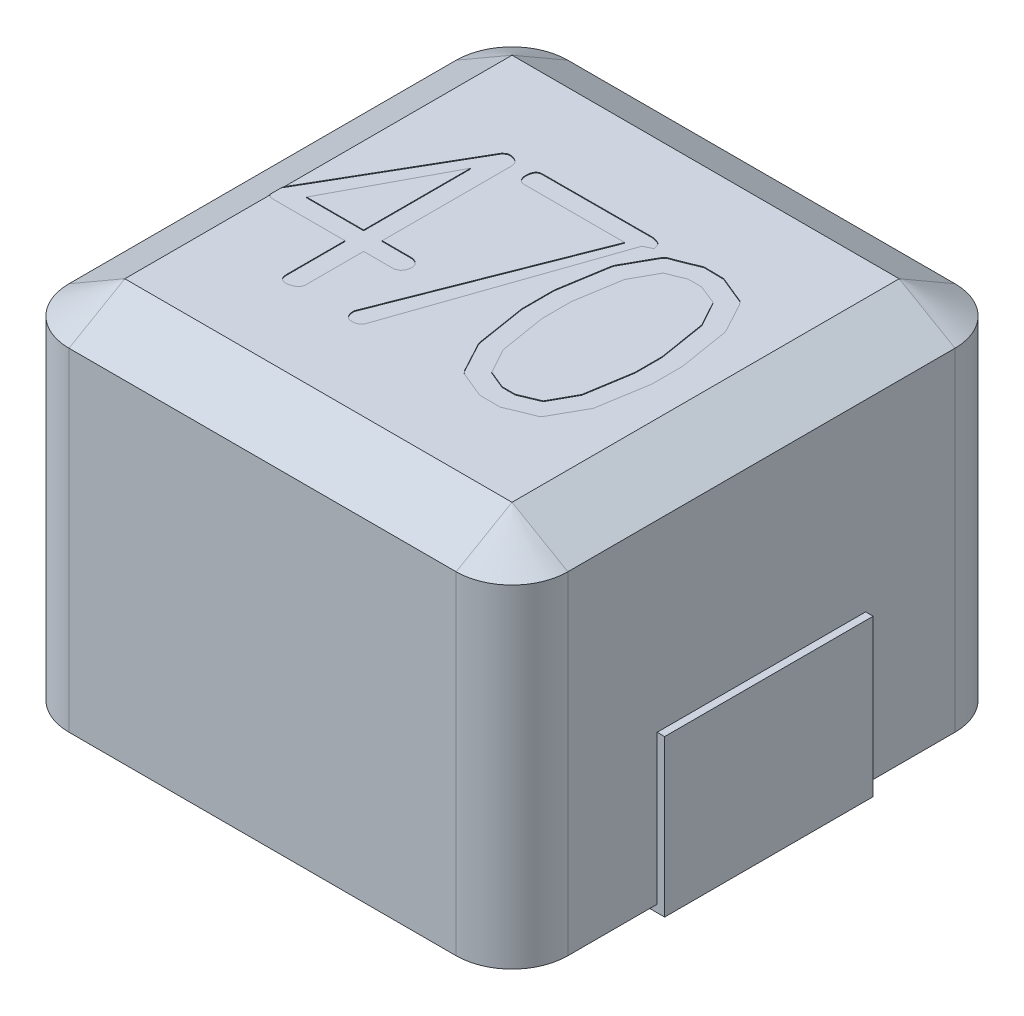
from build123d import *

# Parameters (mm, degrees)
BOSS_EXTRUDE1_DEPTH      = 4.9
BOSS_EXTRUDE3_DEPTH      = 0.1
BOSS_EXTRUDE3_DEPTH_BACK = 2
SKETCH4_W                = 1.45
SKETCH4_H                = 2.8
CHAMFER1_SIZE            = 0.75
CHAMFER1_SIZE_2          = 0.433012702
CUT_EXTRUDE1_DEPTH       = 0.01


with BuildPart() as part:
    # Sketch1 → Boss-Extrude1 (new body)
    with BuildSketch(Plane(origin=(0, 0, 0), x_dir=(1, 0, 0), z_dir=(0, 1, 0))):
        with BuildLine():
            Line((2.6, -3.35), (-2.6, -3.35))
            ThreePointArc((-2.6, -3.35), (-3.130330086, -3.130330086), (-3.35, -2.6))
            Line((-3.35, -2.6), (-3.35, 2.6))
            ThreePointArc((-3.35, 2.6), (-3.130330086, 3.130330086), (-2.6, 3.35))
            Line((-2.6, 3.35), (2.6, 3.35))
            ThreePointArc((2.6, 3.35), (3.130330086, 3.130330086), (3.35, 2.6))
            Line((3.35, 2.6), (3.35, -2.6))
            ThreePointArc((3.35, -2.6), (3.130330086, -3.130330086), (2.6, -3.35))
        make_face()
    extrude(amount=BOSS_EXTRUDE1_DEPTH)

    # Sketch4 → Boss-Extrude3 (add, two sides: drawn at the far end of the back side and taken through both)
    with BuildSketch(Plane.XZ.offset(-BOSS_EXTRUDE3_DEPTH_BACK)):
        with Locations((-2.725, 0)):
            Rectangle(SKETCH4_W, SKETCH4_H)
        with Locations((2.725, 0)):
            Rectangle(SKETCH4_W, SKETCH4_H)
    extrude(amount=BOSS_EXTRUDE3_DEPTH + BOSS_EXTRUDE3_DEPTH_BACK)

    # Chamfer1
    # the kernel refuses this chamfer: 0.75, 0.433012702 mm, written as the material it takes off along each edge
    with BuildSketch(Plane(origin=(2.6, 4.9, -2.6), x_dir=(0, 0, -1), z_dir=(-1, 0, 0))) as chamfer1_piece_1:
        Polygon((0.75 - CHAMFER1_SIZE, 0), (0.75, CHAMFER1_SIZE_2), (0.75, 0), align=None)
    revolve(axis=Axis((2.6, 4.9, -2.6), (0, -1, 0)), revolution_arc=90, mode=Mode.SUBTRACT)
    with BuildSketch(Plane(origin=(-2.6, 4.9, -3.35), x_dir=(0, 0, 1), z_dir=(1, 0, 0)), Plane(origin=(-3.35, 4.9, 2.6), x_dir=(1, 0, 0), z_dir=(0, 0, -1)), Plane(origin=(3.35, 4.9, -2.6), x_dir=(-1, 0, 0), z_dir=(0, 0, 1))) as chamfer1_piece_2:
        Polygon((CHAMFER1_SIZE, 0), (0, CHAMFER1_SIZE_2), (0, 0), align=None)
    extrude(amount=5.2, mode=Mode.SUBTRACT)
    with BuildSketch(Plane(origin=(-2.6, 4.9, -2.6), x_dir=(-1, 0, 0), z_dir=(0, 0, 1))) as chamfer1_piece_3:
        Polygon((0.75 - CHAMFER1_SIZE, 0), (0.75, CHAMFER1_SIZE_2), (0.75, 0), align=None)
    revolve(axis=Axis((-2.6, 4.9, -2.6), (0, -1, 0)), revolution_arc=90, mode=Mode.SUBTRACT)
    with BuildSketch(Plane(origin=(-2.6, 4.9, 2.6), x_dir=(0, 0, 1), z_dir=(1, 0, 0))) as chamfer1_piece_4:
        Polygon((0.75, CHAMFER1_SIZE_2), (0.75 - CHAMFER1_SIZE, 0), (0.75, 0), align=None)
    revolve(axis=Axis((-2.6, 4.9, 2.6), (0, -1, 0)), revolution_arc=90, mode=Mode.SUBTRACT)
    with BuildSketch(Plane(origin=(2.6, 4.9, 3.35), x_dir=(0, -1, 0), z_dir=(-1, 0, 0))) as chamfer1_piece_5:
        Polygon((CHAMFER1_SIZE_2, 0), (0, -CHAMFER1_SIZE), (0, 0), align=None)
    extrude(amount=5.2, mode=Mode.SUBTRACT)
    with BuildSketch(Plane(origin=(2.6, 4.9, 2.6), x_dir=(1, 0, 0), z_dir=(0, 0, -1))) as chamfer1_piece_6:
        Polygon((0.75, CHAMFER1_SIZE_2), (0.75 - CHAMFER1_SIZE, 0), (0.75, 0), align=None)
    revolve(axis=Axis((2.6, 4.9, 2.6), (0, -1, 0)), revolution_arc=90, mode=Mode.SUBTRACT)

    # Sketch5 → Cut-Extrude1 (cut)
    # profile 1 of 3: a face of its own
    with BuildSketch(Plane(origin=(0, 4.9, 0), x_dir=(1, 0, 0), z_dir=(0, 1, 0))):
        with BuildLine():
            Line((-1.328236607, 1.359375), (-1.314285714, 1.320870536))
            Line((-1.314285714, 1.320870536), (-1.314285714, -0.428571429))
            Line((-1.314285714, -0.428571429), (-0.9125, -0.429129464))
            add(Edge.make_bspline(
                [(-0.9125, -0.429129464), (-0.897093014, -0.433105667), (-0.868877176, -0.440387552), (-0.833610111, -0.463054424), (-0.80954199, -0.494478658), (-0.804932585, -0.519516334), (-0.802566964, -0.532366071)],
                knots=[0, 0, 0, 0, 1.169459646, 2.1417093, 3.046295384, 4, 4, 4, 4], degree=3))
            add(Edge.make_bspline(
                [(-0.802566964, -0.532366071), (-0.803037702, -0.544335165), (-0.803940648, -0.567293681), (-0.812625138, -0.599642555), (-0.82625169, -0.628681593), (-0.840620971, -0.643738691), (-0.847767857, -0.651227679)],
                knots=[0, 0, 0, 0, 1.095690159, 2.101697989, 3.055836587, 4, 4, 4, 4], degree=3))
            Line((-0.847767857, -0.651227679), (-0.901339286, -0.678571429))
            Line((-0.901339286, -0.678571429), (-1.314285714, -0.678571429))
            Line((-1.314285714, -0.678571429), (-1.314285714, -1.470424107))
            add(Edge.make_bspline(
                [(-1.314285714, -1.470424107), (-1.317041098, -1.479342826), (-1.322350364, -1.496528035), (-1.336817441, -1.518908082), (-1.355706657, -1.536922254), (-1.38505703, -1.552047448), (-1.418818779, -1.565014952), (-1.445715251, -1.569516136), (-1.457142857, -1.571428571)],
                knots=[0, 0, 0, 0, 0.895387976, 1.725295879, 2.536428694, 3.378620822, 4.886244683, 6, 6, 6, 6], degree=3))
            add(Edge.make_bspline(
                [(-1.457142857, -1.571428571), (-1.465538655, -1.57114638), (-1.481385508, -1.570613751), (-1.503595535, -1.565650756), (-1.522296111, -1.557160086), (-1.53827013, -1.545834559), (-1.549908975, -1.530274693), (-1.558612056, -1.511712826), (-1.563410103, -1.489819979), (-1.563984564, -1.474166092), (-1.564285714, -1.465959821)],
                knots=[0, 0, 0, 0, 1.168965484, 2.206392299, 3.145950951, 4.016860765, 4.903443245, 5.819468469, 6.856895284, 8, 8, 8, 8], degree=3))
            Line((-1.564285714, -1.465959821), (-1.564285714, -0.678571429))
            Line((-1.564285714, -0.678571429), (-2.548102679, -0.678571429))
            add(Edge.make_bspline(
                [(-2.548102679, -0.678571429), (-2.558789805, -0.675686891), (-2.579561851, -0.670080355), (-2.60636965, -0.650444523), (-2.624994544, -0.6214544), (-2.631993254, -0.59899477), (-2.635714286, -0.587053571)],
                knots=[0, 0, 0, 0, 0.981167136, 1.907046662, 2.887231297, 4, 4, 4, 4], degree=3))
            Line((-2.635714286, -0.587053571), (-2.635714286, -0.55859375))
            add(Edge.make_bspline(
                [(-2.635714286, -0.55859375), (-2.634946315, -0.544774547), (-2.63342016, -0.517312239), (-2.621158488, -0.4926973), (-2.615066964, -0.48046875)],
                knots=[0, 0, 0, 0, 1.00641232, 2, 2, 2, 2], degree=3))
            Line((-2.615066964, -0.48046875), (-2.487834821, -0.262834821))
            Line((-2.487834821, -0.262834821), (-1.530803571, 1.391741071))
            add(Edge.make_bspline(
                [(-1.530803571, 1.391741071), (-1.524230064, 1.397291643), (-1.511973952, 1.407640521), (-1.492772636, 1.420007791), (-1.473437703, 1.427107677), (-1.46053977, 1.428096901), (-1.454352679, 1.428571429)],
                knots=[0, 0, 0, 0, 1.18923455, 2.217292782, 3.144841935, 4, 4, 4, 4], degree=3))
            add(Edge.make_bspline(
                [(-1.454352679, 1.428571429), (-1.448750645, 1.427948344), (-1.437266156, 1.426670986), (-1.426054968, 1.423868496), (-1.4203125, 1.422433036)],
                knots=[0, 0, 0, 0, 0.975582543, 2, 2, 2, 2], degree=3))
            add(Edge.make_bspline(
                [(-1.4203125, 1.422433036), (-1.408187694, 1.419450593), (-1.386148598, 1.414029447), (-1.358761239, 1.399009869), (-1.337676787, 1.38183954), (-1.331275739, 1.366607139), (-1.328236607, 1.359375)],
                knots=[0, 0, 0, 0, 1.277997596, 2.322998947, 3.203782403, 4, 4, 4, 4], degree=3))
        make_face()
        Polygon((-2.329352679, -0.428571429), (-1.564285714, -0.428571429), (-1.564285714, 1.0078125), align=None, mode=Mode.SUBTRACT)
    # profile 2 of 3: a face of its own
    with BuildSketch(Plane(origin=(0, 4.9, 0), x_dir=(1, 0, 0), z_dir=(0, 1, 0))):
        with BuildLine():
            add(Edge.make_bspline(
                [(0.588504464, 1.364955357), (0.592519255, 1.352783846), (0.599253982, 1.332366388), (0.601931878, 1.311060223), (0.603013393, 1.302455357)],
                knots=[0, 0, 0, 0, 1.192265105, 2, 2, 2, 2], degree=3))
            add(Edge.make_bspline(
                [(0.603013393, 1.302455357), (0.584277728, 1.294552645), (0.546827601, 1.278756164), (0.510989342, 1.259581769), (0.493080357, 1.25)],
                knots=[0, 0, 0, 0, 1.000566157, 2, 2, 2, 2], degree=3))
            Line((0.493080357, 1.25), (-0.46171875, -1.509486607))
            add(Edge.make_bspline(
                [(-0.46171875, -1.509486607), (-0.466784138, -1.519189971), (-0.476917172, -1.538601026), (-0.506085233, -1.558009966), (-0.542633793, -1.569858446), (-0.570042246, -1.570873156), (-0.585044643, -1.571428571)],
                knots=[0, 0, 0, 0, 0.882857716, 1.766109243, 2.777248931, 4, 4, 4, 4], degree=3))
            add(Edge.make_bspline(
                [(-0.585044643, -1.571428571), (-0.595442277, -1.570638705), (-0.615461315, -1.569117939), (-0.642865276, -1.555107196), (-0.665024445, -1.532181838), (-0.674006262, -1.512282715), (-0.678794643, -1.501674107)],
                knots=[0, 0, 0, 0, 0.994087639, 1.913962092, 2.887892821, 4, 4, 4, 4], degree=3))
            add(Edge.make_bspline(
                [(-0.678794643, -1.501674107), (-0.681153593, -1.492042444), (-0.686934586, -1.468438477), (-0.687079435, -1.444096604), (-0.687165179, -1.4296875)],
                knots=[0, 0, 0, 0, 0.816105494, 2, 2, 2, 2], degree=3))
            Line((-0.687165179, -1.4296875), (0.333482143, 1.178571429))
            Line((0.333482143, 1.178571429), (-1.027566964, 1.178571429))
            add(Edge.make_bspline(
                [(-1.027566964, 1.178571429), (-1.037734593, 1.181245119), (-1.05723919, 1.186374068), (-1.080859558, 1.204831186), (-1.098437225, 1.229166128), (-1.103539365, 1.248602518), (-1.10625, 1.258928571)],
                knots=[0, 0, 0, 0, 1.043720753, 2.002173106, 2.938606004, 4, 4, 4, 4], degree=3))
            add(Edge.make_bspline(
                [(-1.10625, 1.258928571), (-1.107534651, 1.264488826), (-1.110920487, 1.279143477), (-1.110793248, 1.294217054), (-1.110714286, 1.303571429)],
                knots=[0, 0, 0, 0, 0.758838176, 2, 2, 2, 2], degree=3))
            add(Edge.make_bspline(
                [(-1.110714286, 1.303571429), (-1.109648985, 1.318758375), (-1.107594685, 1.348044522), (-1.094159018, 1.382426682), (-1.076794488, 1.404025139), (-1.060371704, 1.416094702), (-1.040174396, 1.423089596), (-1.025764579, 1.423753244), (-1.018080357, 1.424107143)],
                knots=[0, 0, 0, 0, 1.596771473, 3.079176304, 3.788109661, 4.488624051, 5.194039107, 6, 6, 6, 6], degree=3))
            Line((-1.018080357, 1.424107143), (0.46015625, 1.428013393))
            add(Edge.make_bspline(
                [(0.46015625, 1.428013393), (0.476288371, 1.42535857), (0.50534402, 1.420576955), (0.543220544, 1.407306391), (0.572421743, 1.389891403), (0.583404952, 1.372862083), (0.588504464, 1.364955357)],
                knots=[0, 0, 0, 0, 1.320336646, 2.378065315, 3.24693451, 4, 4, 4, 4], degree=3))
        make_face()
    # profile 3 of 3: a face of its own
    with BuildSketch(Plane(origin=(0, 4.9, 0), x_dir=(1, 0, 0), z_dir=(0, 1, 0))):
        with BuildLine():
            add(Edge.make_bspline(
                [(1.420982143, 1.423549107), (1.431197745, 1.419049579), (1.453238344, 1.409341653), (1.488735763, 1.394639458), (1.528455668, 1.377423565), (1.573125274, 1.360166962), (1.621645086, 1.339738016), (1.674694527, 1.317783643), (1.732713636, 1.295418792), (1.772574363, 1.279092137), (1.793191964, 1.270647321)],
                knots=[0, 0, 0, 0, 0.665720275, 1.436320058, 2.291406459, 3.247277281, 4.291804095, 5.431067394, 6.671242782, 8, 8, 8, 8], degree=3))
            Line((1.793191964, 1.270647321), (1.829464286, 1.227120536))
            Line((1.829464286, 1.227120536), (2.044308036, 0.829241071))
            Line((2.044308036, 0.829241071), (2.056584821, 0.787388393))
            Line((2.056584821, 0.787388393), (2.164285714, 0.125))
            Line((2.164285714, 0.125), (2.164285714, -0.287388393))
            Line((2.164285714, -0.287388393), (2.052678571, -0.965959821))
            Line((2.052678571, -0.965959821), (2.04375, -0.978236607))
            Line((2.04375, -0.978236607), (1.806026786, -1.402901786))
            Line((1.806026786, -1.402901786), (1.784263393, -1.421316964))
            add(Edge.make_bspline(
                [(1.784263393, -1.421316964), (1.770829458, -1.425854996), (1.742273116, -1.435501432), (1.697521402, -1.453351717), (1.647393449, -1.473211942), (1.594279799, -1.49538055), (1.541792089, -1.517441966), (1.494357908, -1.538149392), (1.45319552, -1.55526521), (1.428402566, -1.566359939), (1.417075893, -1.571428571)],
                knots=[0, 0, 0, 0, 0.857514317, 1.822807192, 2.913398912, 4.118988428, 5.303819582, 6.357154914, 7.249465436, 8, 8, 8, 8], degree=3))
            Line((1.417075893, -1.571428571), (1.136941964, -1.571428571))
            add(Edge.make_bspline(
                [(1.136941964, -1.571428571), (1.114386397, -1.562805934), (1.064563542, -1.543759444), (0.983727404, -1.509524954), (0.888369778, -1.470454154), (0.820491201, -1.4413269), (0.784263393, -1.42578125)],
                knots=[0, 0, 0, 0, 0.759314602, 1.677245352, 2.760311232, 4, 4, 4, 4], degree=3))
            Line((0.784263393, -1.42578125), (0.753013393, -1.393973214))
            Line((0.753013393, -1.393973214), (0.530357143, -0.979910714))
            Line((0.530357143, -0.979910714), (0.521986607, -0.94921875))
            Line((0.521986607, -0.94921875), (0.414285714, -0.28125))
            Line((0.414285714, -0.28125), (0.414285714, 0.152901786))
            Line((0.414285714, 0.152901786), (0.523102679, 0.820870536))
            Line((0.523102679, 0.820870536), (0.534263393, 0.849888393))
            Line((0.534263393, 0.849888393), (0.760267857, 1.255580357))
            Line((0.760267857, 1.255580357), (0.78984375, 1.284598214))
            add(Edge.make_bspline(
                [(0.78984375, 1.284598214), (0.801599818, 1.288589376), (0.827522095, 1.297389937), (0.868948289, 1.314162919), (0.917911873, 1.332060198), (0.970757003, 1.353717909), (1.023629561, 1.376091569), (1.072762663, 1.395016009), (1.114732752, 1.412754831), (1.140649893, 1.42320723), (1.152566964, 1.428013393)],
                knots=[0, 0, 0, 0, 0.76366452, 1.683889708, 2.748731425, 3.970665397, 5.196932387, 6.280730219, 7.209455205, 8, 8, 8, 8], degree=3))
            Line((1.152566964, 1.428013393), (1.420982143, 1.423549107))
        make_face()
        Polygon((1.626897321, 1.075334821), (1.366294643, 1.178571429), (1.189397321, 1.178571429), (0.948325893, 1.080357143), (0.764174107, 0.746651786), (0.664285714, 0.132254464), (0.664285714, -0.260044643), (0.767522321, -0.88671875), (0.951674107, -1.223772321), (1.188839286, -1.321428571), (1.364620536, -1.321428571), (1.630245536, -1.210379464), (1.814955357, -0.876116071), (1.914285714, -0.260044643), (1.914285714, 0.102120536), (1.811607143, 0.736607143), align=None, mode=Mode.SUBTRACT)
    extrude(amount=-CUT_EXTRUDE1_DEPTH, mode=Mode.SUBTRACT)


solid = part.part
